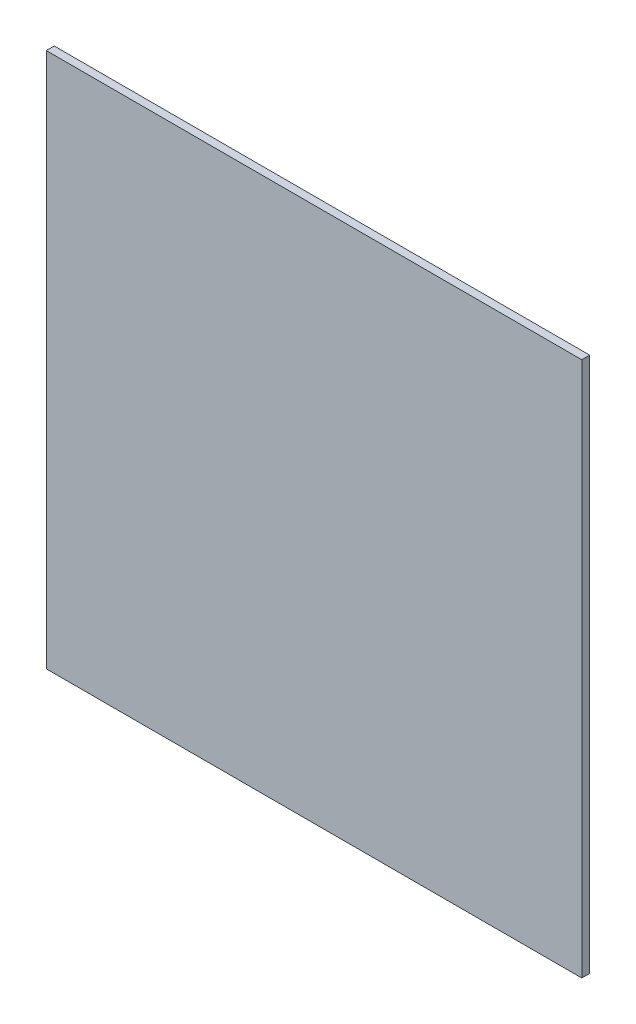
from build123d import *

# Parameters (mm, degrees)
SKIZZE1_W                       = 135
SKIZZE1_H                       = 135
AUFSATZ_LINEAR_AUSTRAGEN1_DEPTH = 2


with BuildPart() as part:
    # Skizze1 → Aufsatz-Linear austragen1 (new body)
    with BuildSketch(Plane.XY):
        Rectangle(SKIZZE1_W, SKIZZE1_H)
    extrude(amount=-AUFSATZ_LINEAR_AUSTRAGEN1_DEPTH)


solid = part.part
